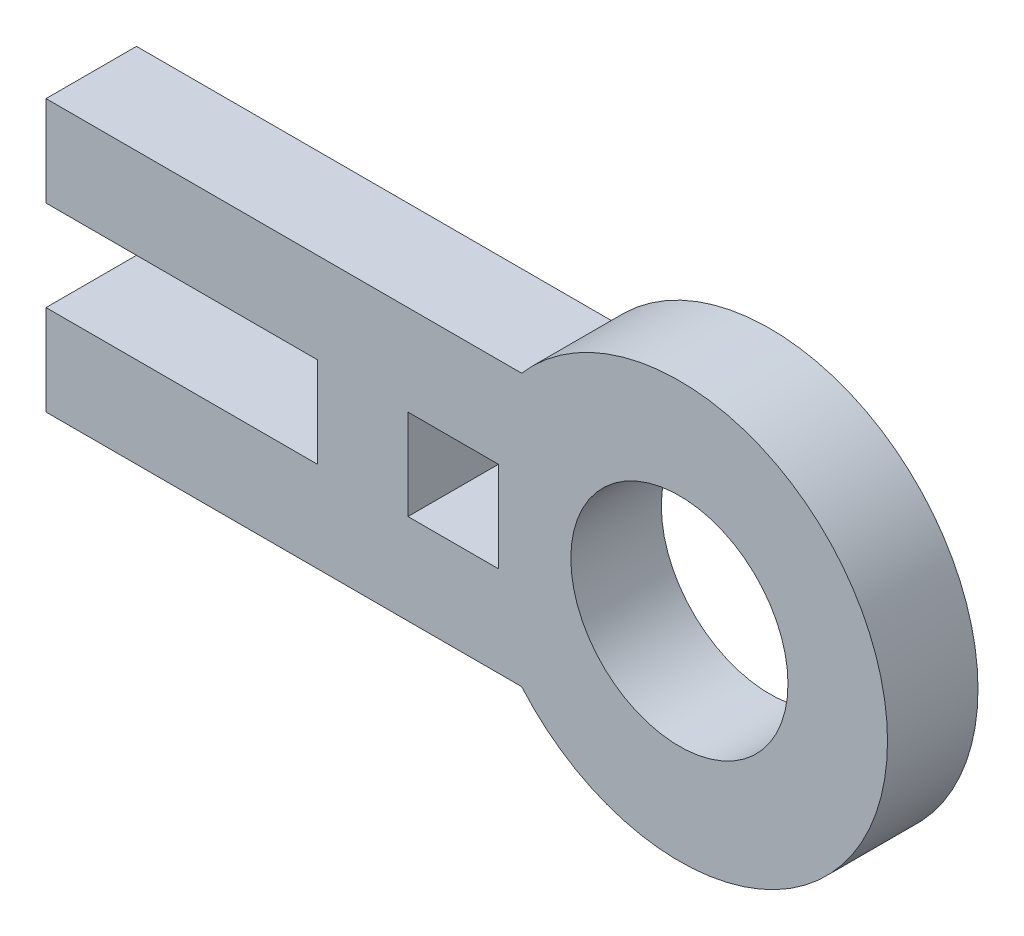
from build123d import *

# Parameters (mm, degrees)
SKETCH1_R           = 6
BOSS_EXTRUDE1_DEPTH = 5
SKETCH2_W           = 5
SKETCH2_H           = 5
CUT_EXTRUDE1_DEPTH  = 5


with BuildPart() as part:
    # Sketch1 → Boss-Extrude1 (new body)
    with BuildSketch(Plane.XY):
        with BuildLine():
            Line((-8.717797887, 7.5), (-35, 7.5))
            Line((-35, 7.5), (-35, 2.5))
            Line((-35, 2.5), (-20, 2.5))
            Line((-20, 2.5), (-20, -2.5))
            Line((-20, -2.5), (-35, -2.5))
            Line((-35, -2.5), (-35, -7.5))
            Line((-35, -7.5), (-8.717797887, -7.5))
            ThreePointArc((-8.717797887, -7.5), (11.5, 0), (-8.717797887, 7.5))
        make_face()
        Circle(SKETCH1_R, mode=Mode.SUBTRACT)
    extrude(amount=BOSS_EXTRUDE1_DEPTH)

    # Sketch2 → Cut-Extrude1 (cut)
    with BuildSketch(Plane.XY.offset(5)):
        with Locations((-12.5, 0)):
            Rectangle(SKETCH2_W, SKETCH2_H)
    extrude(amount=-CUT_EXTRUDE1_DEPTH, mode=Mode.SUBTRACT)


solid = part.part
